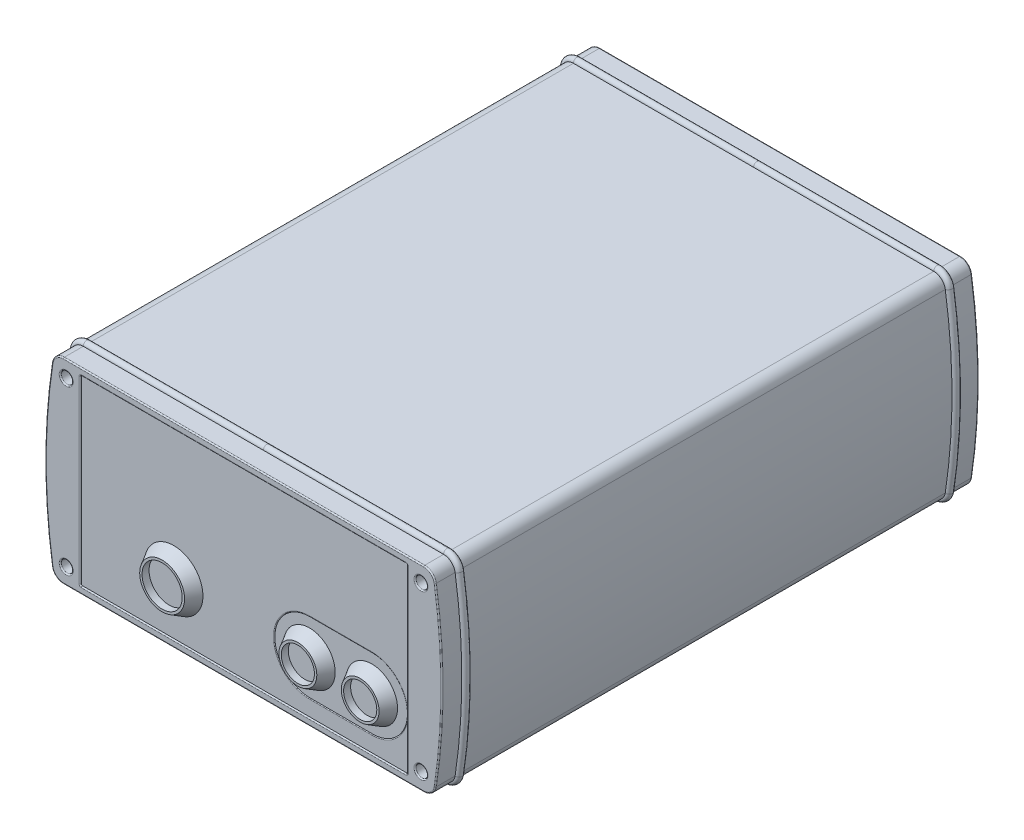
from build123d import *
from OCP.BRepFilletAPI import BRepFilletAPI_MakeChamfer

# Parameters (mm, degrees)
SKETCH1_W               = 172
SKETCH1_H               = 84
BOSS_EXTRUDE1_DEPTH     = 230
CUT_EXTRUDE1_DEPTH      = 300.232351192
FILLET1_R               = 5
SKETCH5_W               = 140
SKETCH5_H               = 78
CUT_EXTRUDE2_DEPTH      = 0.5
FILLET2_R               = 0.5
FILLET3_R               = 0.5
SKETCH6_R               = 2.5
CUT_EXTRUDE3_DEPTH      = 5
MIRROR4_COPY_1_SKETCH_R = 2.5
MIRROR4_COPY_1_DEPTH    = 5
FILLET4_R               = 0.5
SKETCH7_R               = 11
SKETCH7_R_2             = 12.5
BOSS_EXTRUDE3_DEPTH     = 5
CHAMFER1_SIZE           = 5
CHAMFER1_SIZE_2         = 2.886751346
CUT_EXTRUDE4_DEPTH      = 0.2
SKETCH9_R               = 8.613248654
SKETCH9_R_2             = 7.113248654
CUT_EXTRUDE5_DEPTH      = 3
FILLET5_R               = 0.5


# Some blends are built 0.0001 mm under size
with BuildPart() as part:
    # Sketch1 → Boss-Extrude1 (new body)
    with BuildSketch(Plane.XY):
        with Locations((86, 42)):
            Rectangle(SKETCH1_W, SKETCH1_H)
    extrude(amount=BOSS_EXTRUDE1_DEPTH)

    # Sketch2 → Cut-Extrude1 (cut, through all)
    with BuildSketch(Plane.XY.offset(230)):
        with BuildLine():
            Line((-106.133621178, 127.579331818), (16.103899637, 127.579331818))
            ThreePointArc((16.103899637, 127.579331818), (1.000797644, 41.368476984), (16.53925861, -44.764974195))
            Line((16.53925861, -44.764974195), (-106.133621178, -44.764974195))
            Line((-106.133621178, -44.764974195), (-106.133621178, 127.579331818))
        make_face()
    cut_extrude1 = extrude(amount=-CUT_EXTRUDE1_DEPTH, mode=Mode.SUBTRACT)

    # Mirror1: Cut-Extrude1 across plane
    add(cut_extrude1.mirror(Plane(origin=(86, 0, 0), x_dir=(0, 0, 1), z_dir=(1, 0, 0))), mode=Mode.SUBTRACT)

    # Fillet1
    fillet1_edges = [part.edges().sort_by_distance(p)[0] for p in [
        (4.553251188, 0, 115),
        (4.553251188, 84, 115),
        (167.446748812, 84, 115),
        (167.446748812, 0, 115),
    ]]
    fillet(fillet1_edges, radius=FILLET1_R)

    # Sweep1: sweep along a path in Sketch3
    with BuildLine(Plane.XY.offset(220)) as sweep1_path:
        Line((8.809991948, 0), (163.190008052, 0))
        ThreePointArc((163.190008052, 0), (166.447652123, 1.206880558), (168.132661277, 4.244897959))
        ThreePointArc((168.132661277, 4.244897959), (171, 42), (168.132661277, 79.755102041))
        ThreePointArc((168.132661277, 79.755102041), (166.447652123, 82.793119442), (163.190008052, 84))
        Line((163.190008052, 84), (8.809991948, 84))
        ThreePointArc((8.809991948, 84), (5.552347877, 82.793119442), (3.867338723, 79.755102041))
        ThreePointArc((3.867338723, 79.755102041), (1, 42), (3.867338723, 4.244897959))
        ThreePointArc((3.867338723, 4.244897959), (5.552347877, 1.206880558), (8.809991948, 0))
    # Sketch4 → Sweep1 (sweep)
    with BuildSketch(Plane(origin=(86, 0, 0), x_dir=(0, 0, -1), z_dir=(1, 0, 0))):
        with BuildLine():
            Line((-218.5, 84), (-221.5, 84))
            ThreePointArc((-221.5, 84), (-220, 85.5), (-218.5, 84))
        make_face()
    sweep1 = sweep(path=sweep1_path.line)

    # Mirror2: Sweep1 across plane
    add(sweep1.mirror(Plane.XY.offset(115)))

    # Sketch5 → Cut-Extrude2 (cut)
    with BuildSketch(Plane.XY.offset(230)):
        with Locations((86, 42)):
            Rectangle(SKETCH5_W, SKETCH5_H)
    extrude(amount=-CUT_EXTRUDE2_DEPTH, mode=Mode.SUBTRACT)

    # Fillet2
    fillet2_edges = [part.edges().sort_by_distance(p)[0] for p in [
        (86, 81, 230),
        (16, 81, 229.75),
        (156, 42, 230),
        (156, 81, 229.75),
        (156, 3, 229.75),
        (16, 3, 229.75),
        (16, 42, 230),
        (86, 3, 230),
    ]]
    fillet(fillet2_edges, radius=FILLET2_R - 0.0001)  # a hair under: the kernel refuses the full size

    # Fillet3
    fillet3_edges = [part.edges().sort_by_distance(p)[0] for p in [
        (86, 0, 230),
        (86, 0, 0),
        (86, 84, 0),
        (171, 42, 0),
        (1, 42, 0),
        (5.552347877, 82.793119442, 0),
        (166.447652123, 82.793119442, 0),
        (166.447652123, 1.206880558, 0),
        (5.552347877, 1.206880558, 0),
        (1, 42, 230),
        (171, 42, 230),
        (86, 84, 230),
        (5.552347877, 82.793119442, 230),
        (166.447652123, 82.793119442, 230),
        (166.447652123, 1.206880558, 230),
        (5.552347877, 1.206880558, 230),
    ]]
    fillet(fillet3_edges, radius=FILLET3_R)

    # Sketch6 → Cut-Extrude3 (cut)
    with BuildSketch(Plane.XY.offset(230)):
        with Locations((10, 77)):
            Circle(SKETCH6_R)
    cut_extrude3 = extrude(amount=-CUT_EXTRUDE3_DEPTH, mode=Mode.SUBTRACT)

    # Mirror3: Cut-Extrude3 across plane
    add(cut_extrude3.mirror(Plane(origin=(86, 0, 0), x_dir=(0, 0, 1), z_dir=(1, 0, 0))), mode=Mode.SUBTRACT)

    # Mirror4: Cut-Extrude3 across plane
    add(cut_extrude3.mirror(Plane.ZX.offset(42)), mode=Mode.SUBTRACT)

    # Mirror4 copy 1 sketch → Mirror4 copy 1 (cut)
    with BuildSketch(Plane(origin=(172, 84, 230), x_dir=(-1, 0, 0), z_dir=(0, 0, 1))):
        with Locations((10, 77)):
            Circle(MIRROR4_COPY_1_SKETCH_R)
    extrude(amount=-MIRROR4_COPY_1_DEPTH, mode=Mode.SUBTRACT)

    # Fillet4
    fillet4_edges = [part.edges().sort_by_distance(p)[0] for p in [
        (7.5, 77, 230),
        (164.5, 77, 230),
        (7.5, 7, 230),
        (164.5, 7, 230),
    ]]
    fillet(fillet4_edges, radius=FILLET4_R)

    # Sketch7 → Boss-Extrude3 (add)
    with BuildSketch(Plane.XY.offset(229.5)):
        with Locations(Location((113.758574045, 24.984911334, 0), (0, 0, 180))):
            Circle(SKETCH7_R)
        with Locations(Location((140.461713247, 24.984911334, 0), (0, 0, 180))):
            Circle(SKETCH7_R)
        with Locations(Location((55.605076702, 24.984911334, 0), (0, 0, 180))):
            Circle(SKETCH7_R_2)
    extrude(amount=BOSS_EXTRUDE3_DEPTH)

    # Chamfer1
    chamfer1_edges_1 = [part.edges().sort_by_distance(p)[0] for p in [
        (124.758574045, 24.984911334, 234.5),
    ]]
    chamfer1_side_1 = [part.faces().sort_by_distance(p)[0] for p in [
        (124.758574045, 24.984911334, 234.442264973),
    ]]
    chamfer1_edges_2 = [part.edges().sort_by_distance(p)[0] for p in [
        (151.461713247, 24.984911334, 234.5),
    ]]
    chamfer1_side_2 = [part.faces().sort_by_distance(p)[0] for p in [
        (151.461713247, 24.984911334, 234.442264973),
    ]]
    chamfer1_edges_3 = [part.edges().sort_by_distance(p)[0] for p in [
        (68.105076702, 24.984911334, 234.5),
    ]]
    chamfer1_side_3 = [part.faces().sort_by_distance(p)[0] for p in [
        (68.105076702, 24.984911334, 234.442264973),
    ]]
    chamfer1 = BRepFilletAPI_MakeChamfer(part.part.solid().wrapped)
    for e in chamfer1_edges_1:
        chamfer1.Add(CHAMFER1_SIZE - 0.0001, CHAMFER1_SIZE_2 - 0.0001, e.wrapped, chamfer1_side_1[0].wrapped)
    for e in chamfer1_edges_2:
        chamfer1.Add(CHAMFER1_SIZE - 0.0001, CHAMFER1_SIZE_2 - 0.0001, e.wrapped, chamfer1_side_2[0].wrapped)
    for e in chamfer1_edges_3:
        chamfer1.Add(CHAMFER1_SIZE - 0.0001, CHAMFER1_SIZE_2 - 0.0001, e.wrapped, chamfer1_side_3[0].wrapped)
    add(Compound.cast(chamfer1.Shape()), mode=Mode.REPLACE)  # a hair under: the kernel refuses the full size

    # Sketch8 → Cut-Extrude4 (cut)
    with BuildSketch(Plane.XY.offset(229.5)):
        with BuildLine():
            Line((113.758574045, 40.044594504), (140.461713247, 40.044594504))
            ThreePointArc((140.461713247, 40.044594504), (155.521396417, 24.984911334), (140.461713247, 9.925228165))
            Line((140.461713247, 9.925228165), (113.758574045, 9.925228165))
            ThreePointArc((113.758574045, 9.925228165), (98.698890875, 24.984911334), (113.758574045, 40.044594504))
        make_face()
    extrude(amount=-CUT_EXTRUDE4_DEPTH, mode=Mode.SUBTRACT)


with BuildPart() as cut_extrude4_piece_1:
    # of the separate pieces the step leaves, piece 1, a body of its own (cut_extrude4_pieces)
    add(part.part.solids().sort_by_distance((16.4999, 81, 229.5))[0])


with BuildPart() as cut_extrude4_piece_2:
    # of the separate pieces the step leaves, piece 2, a body of its own (cut_extrude4_pieces)
    add(part.part.solids().sort_by_distance((102.758574045, 24.984911334, 229.5001))[0])


with BuildPart() as cut_extrude4_piece_3:
    # of the separate pieces the step leaves, piece 3, a body of its own (cut_extrude4_pieces)
    add(part.part.solids().sort_by_distance((129.461713247, 24.984911334, 229.5001))[0])


with BuildPart() as cut_extrude5_tool:
    # Sketch9 → Cut-Extrude5 (new body)
    with BuildSketch(Plane.XY.offset(234.5)):
        with Locations((55.605076702, 24.984911334)):
            Circle(SKETCH9_R)
        with Locations((113.758574045, 24.984911334)):
            Circle(SKETCH9_R_2)
        with Locations((140.461713247, 24.984911334)):
            Circle(SKETCH9_R_2)
    extrude(amount=-CUT_EXTRUDE5_DEPTH)


with BuildPart() as cut_extrude4_piece_1_1:
    add(cut_extrude4_piece_1.part)

    # Cut-Extrude5: cut by cut_extrude5_tool
    add(cut_extrude5_tool.part, mode=Mode.SUBTRACT)

    # Fillet5
    # the kernel refuses this fillet: 0.5 mm, written as the material it takes off along each edge
    with BuildSketch(Plane(origin=(113.758574045, 24.984911334, 229.5), x_dir=(0, -1, 0), z_dir=(1, 0, 0))) as fillet5_piece_1:
        with BuildLine():
            CenterArc((15.45968317, 0.5), FILLET5_R, 216.869897645, 53.130102355)
            Line((15.05968317, 0.2), (15.05168317, 0.194))
            ThreePointArc((15.05168317, 0.194), (15.04968317, 0.1), (15.04968317, 0))
            Line((15.04968317, 0), (15.05968317, -0.01))
            Line((15.05968317, -0.01), (15.45968317, -0.01))
            Line((15.45968317, -0.01), (15.45968317, 0))
        make_face()
    revolve(axis=Axis((113.758574045, 24.984911334, 229.5), (0, 0, -1)), revolution_arc=180, mode=Mode.SUBTRACT)
    with BuildSketch(Plane(origin=(140.461713247, 9.925228165, 229.5), x_dir=(0, -1, 0), z_dir=(-1, 0, 0)), Plane(origin=(113.758574045, 40.044594504, 229.5), x_dir=(0, 1, 0), z_dir=(1, 0, 0))) as fillet5_piece_2:
        with BuildLine():
            CenterArc((0.4, -0.5), FILLET5_R, 90, 53.130102355)
            Line((0, -0.2), (-0.008, -0.194))
            ThreePointArc((-0.008, -0.194), (-0.01, -0.1), (-0.01, 0))
            Line((-0.01, 0), (0, 0.01))
            Line((0, 0.01), (0.4, 0.01))
            Line((0.4, 0.01), (0.4, 0))
        make_face()
    extrude(amount=26.703139202, mode=Mode.SUBTRACT)
    with BuildSketch(Plane(origin=(140.461713247, 24.984911334, 229.5), x_dir=(0, 1, 0), z_dir=(-1, 0, 0))) as fillet5_piece_3:
        with BuildLine():
            CenterArc((15.45968317, 0.5), FILLET5_R, 216.869897645, 53.130102355)
            Line((15.05968317, 0.2), (15.05168317, 0.194))
            ThreePointArc((15.05168317, 0.194), (15.04968317, 0.1), (15.04968317, 0))
            Line((15.04968317, 0), (15.05968317, -0.01))
            Line((15.05968317, -0.01), (15.45968317, -0.01))
            Line((15.45968317, -0.01), (15.45968317, 0))
        make_face()
    revolve(axis=Axis((140.461713247, 24.984911334, 229.5), (0, 0, -1)), revolution_arc=180, mode=Mode.SUBTRACT)


with BuildPart() as cut_extrude4_piece_2_1:
    add(cut_extrude4_piece_2.part)

    # Cut-Extrude5: cut by cut_extrude5_tool
    add(cut_extrude5_tool.part, mode=Mode.SUBTRACT)


with BuildPart() as cut_extrude4_piece_3_1:
    add(cut_extrude4_piece_3.part)

    # Cut-Extrude5: cut by cut_extrude5_tool
    add(cut_extrude5_tool.part, mode=Mode.SUBTRACT)


solid = Compound([cut_extrude4_piece_1_1.part, cut_extrude4_piece_2_1.part, cut_extrude4_piece_3_1.part])
